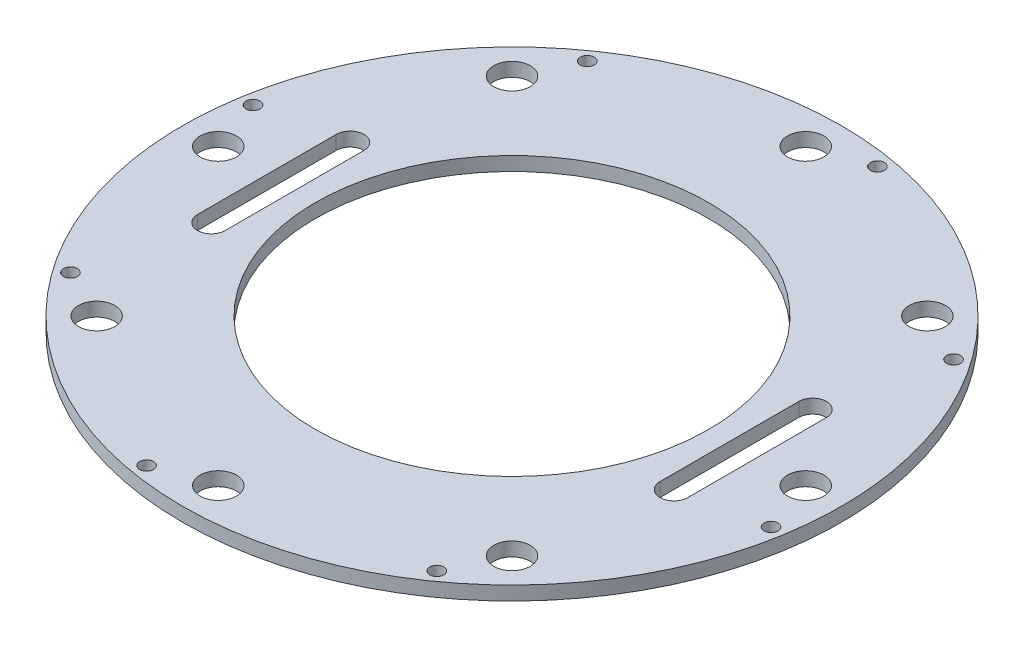
from build123d import *

# Parameters (mm, degrees)
SKETCH1_R           = 14.25
SKETCH1_R_2         = 0.3
SKETCH1_R_3         = 0.7874
SKETCH1_R_4         = 8.5
BOSS_EXTRUDE1_DEPTH = 0.6


with BuildPart() as part:
    # Sketch1 → Boss-Extrude1 (new body)
    with BuildSketch(Plane(origin=(0, 0, 0), x_dir=(1, 0, 0), z_dir=(0, 1, 0))):
        Circle(SKETCH1_R)
        with Locations((-11.172287143, -7.919595949)):
            Circle(SKETCH1_R_2, mode=Mode.SUBTRACT)
        with Locations((-8.980256121, -8.980256121)):
            Circle(SKETCH1_R_3, mode=Mode.SUBTRACT)
        with Locations((-2.3, -13.5)):
            Circle(SKETCH1_R_2, mode=Mode.SUBTRACT)
        with Locations((0, -12.7)):
            Circle(SKETCH1_R_3, mode=Mode.SUBTRACT)
        with Locations((7.919595949, -11.172287143)):
            Circle(SKETCH1_R_2, mode=Mode.SUBTRACT)
        with Locations((8.980256121, -8.980256121)):
            Circle(SKETCH1_R_3, mode=Mode.SUBTRACT)
        with Locations((13.5, -2.3)):
            Circle(SKETCH1_R_2, mode=Mode.SUBTRACT)
        with Locations((12.7, 0)):
            Circle(SKETCH1_R_3, mode=Mode.SUBTRACT)
        with Locations((-12.7, 0)):
            Circle(SKETCH1_R_3, mode=Mode.SUBTRACT)
        with Locations((-13.5, 2.3)):
            Circle(SKETCH1_R_2, mode=Mode.SUBTRACT)
        with BuildLine():
            Line((-9.4, 3), (-9.4, -3))
            ThreePointArc((-9.4, -3), (-10, -3.6), (-10.6, -3))
            Line((-10.6, -3), (-10.6, 3))
            ThreePointArc((-10.6, 3), (-10, 3.6), (-9.4, 3))
        make_face(mode=Mode.SUBTRACT)
        with Locations((-8.980256121, 8.980256121)):
            Circle(SKETCH1_R_3, mode=Mode.SUBTRACT)
        with Locations((-7.919595949, 11.172287143)):
            Circle(SKETCH1_R_2, mode=Mode.SUBTRACT)
        Circle(SKETCH1_R_4, mode=Mode.SUBTRACT)
        with BuildLine():
            ThreePointArc((10.6, -3), (10, -3.6), (9.4, -3))
            Line((9.4, -3), (9.4, 3))
            ThreePointArc((9.4, 3), (10, 3.6), (10.6, 3))
            Line((10.6, 3), (10.6, -3))
        make_face(mode=Mode.SUBTRACT)
        with Locations((0, 12.7)):
            Circle(SKETCH1_R_3, mode=Mode.SUBTRACT)
        with Locations((2.3, 13.5)):
            Circle(SKETCH1_R_2, mode=Mode.SUBTRACT)
        with Locations((8.980256121, 8.980256121)):
            Circle(SKETCH1_R_3, mode=Mode.SUBTRACT)
        with Locations((11.172287143, 7.919595949)):
            Circle(SKETCH1_R_2, mode=Mode.SUBTRACT)
    extrude(amount=BOSS_EXTRUDE1_DEPTH)


solid = part.part
